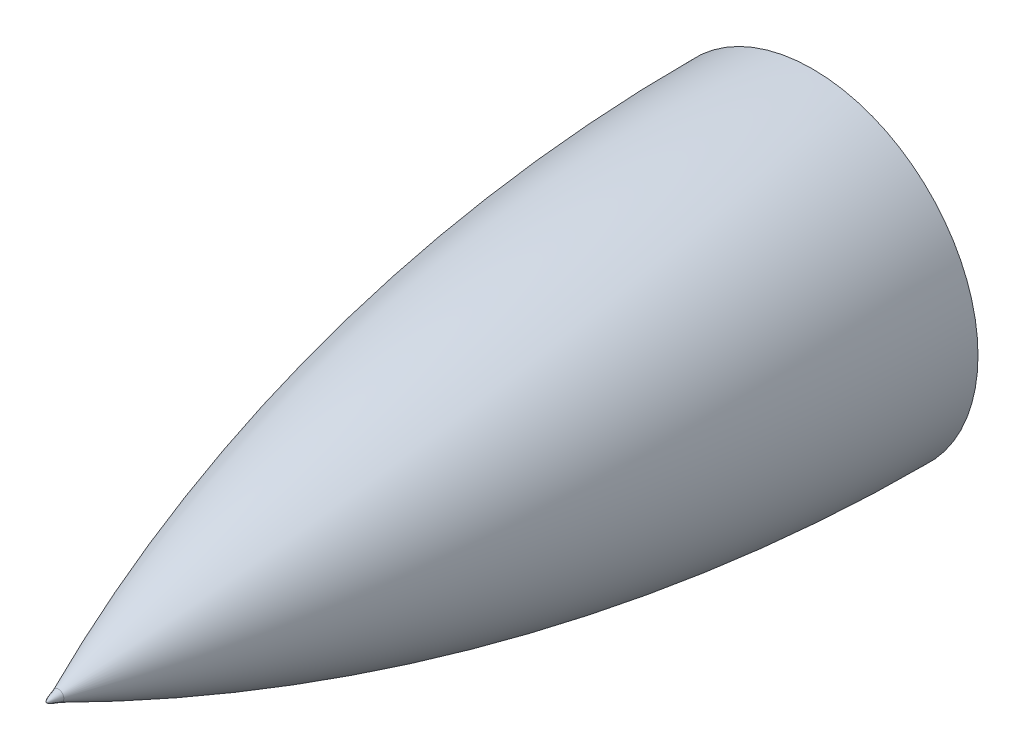
from build123d import *


with BuildPart() as part:
    # Sketch1 → Revolve2 (revolve)
    with BuildSketch(Plane(origin=(0, 0, 0), x_dir=(0, 0, -1), z_dir=(1, 0, 0))):
        with BuildLine():
            Line((0, 460.743902439), (0, 459.243902439))
            ThreePointArc((0, 459.243902439), (-27.046947782, 458.446752135), (-54, 456.058068592))
            Line((-54, 456.058068592), (-54, 454.54755551))
            ThreePointArc((-54, 454.54755551), (-119.575453409, 441.849738217), (-182.604864627, 419.743902439))
            Line((-182.604864627, 419.743902439), (-190, 419.743902439))
            ThreePointArc((-190, 419.743902439), (-97.186676042, 450.377279217), (0, 460.743902439))
        make_face()
    revolve(axis=Axis((0, 419.743902439, 190), (0, 0, -1)))

    # Sketch2 → Cut-Revolve1 (revolve, cut)
    with BuildSketch(Plane(origin=(0, 0, 0), x_dir=(0, 0, -1), z_dir=(1, 0, 0))):
        with BuildLine():
            Line((-190, 419.743902439), (-187, 419.743902439))
            Line((-187, 419.743902439), (-187, 421.088997285))
            ThreePointArc((-187, 421.088997285), (-188.501199784, 420.419125772), (-190, 419.743902439))
        make_face()
    revolve(axis=Axis((0, 419.743902439, 190), (0, 0, -1)), mode=Mode.SUBTRACT)

    # Sketch3 → Revolve3 (revolve)
    with BuildSketch(Plane(origin=(0, 0, 0), x_dir=(0, 0, -1), z_dir=(1, 0, 0))):
        with BuildLine():
            Line((-190, 419.743902439), (-187, 419.743902439))
            Line((-187, 419.743902439), (-187, 421.088997285))
            add(Edge.make_bspline(
                [(-187, 421.088997285), (-188.123166004, 420.713175649), (-189.930551622, 420.252355821), (-190, 419.743902439)],
                knots=[0, 0, 0, 0, 0.5, 0.5, 0.5, 0.5], degree=3))
        make_face()
    revolve(axis=Axis((0, 419.743902439, 187), (0, 0, 1)))


solid = part.part
